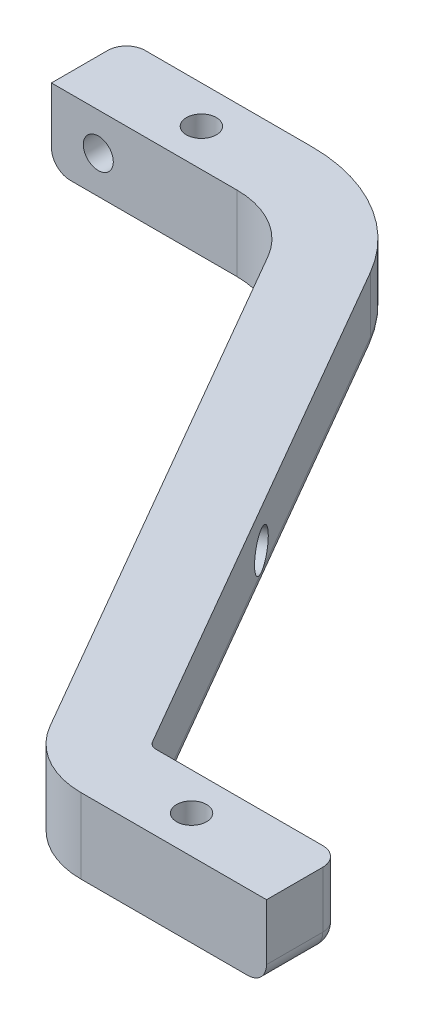
from build123d import *

# Parameters (mm, degrees)
EXTRU_MINCE1_DEPTH      = 8
ESQUISSE2_R             = 1.6
ENL_V_MAT_EXTRU_1_DEPTH = 109.260681026
ESQUISSE3_R             = 2
ENL_V_MAT_EXTRU_2_DEPTH = 5.5
ESQUISSE4_R             = 1.6
ENL_V_MAT_EXTRU_3_DEPTH = 109.260681026
ESQUISSE5_R             = 2
ENL_V_MAT_EXTRU_4_DEPTH = 5.5
ESQUISSE7_R             = 1.6
ENL_V_MAT_EXTRU_5_DEPTH = 102.558480966
ESQUISSE8_R             = 2
ENL_V_MAT_EXTRU_6_DEPTH = 5.5
CONG_1_R                = 2


with BuildPart() as part:
    # Esquisse1 → Extru.-Mince1 (new body)
    with BuildSketch(Plane(origin=(0, 0, 0), x_dir=(1, 0, 0), z_dir=(0, 1, 0))):
        with BuildLine():
            Line((0, 0), (19.803847577, 0))
            ThreePointArc((19.803847577, 0), (24.303847577, -1.205771366), (27.598076211, -4.5))
            Line((27.598076211, -4.5), (59.352341017, -59.5))
            ThreePointArc((59.352341017, -59.5), (62.646569651, -62.794228634), (67.146569651, -64))
            Line((67.146569651, -64), (86.950417228, -64))
            Line((86.950417228, -64), (86.950417228, -56))
            Line((86.950417228, -56), (67.146569651, -56))
            ThreePointArc((67.146569651, -56), (66.646569651, -55.866025404), (66.280544247, -55.5))
            Line((66.280544247, -55.5), (34.526279442, -0.5))
            ThreePointArc((34.526279442, -0.5), (28.303847577, 5.722431864), (19.803847577, 8))
            Line((19.803847577, 8), (0, 8))
            Line((0, 8), (0, 0))
        make_face()
    extrude(amount=EXTRU_MINCE1_DEPTH)

    # Esquisse2 → Enlèv. mat.-Extru.1 (cut, through all)
    with BuildSketch(Plane(origin=(0, 8, 0), x_dir=(1, 0, 0), z_dir=(0, 1, 0))):
        with Locations(Location((74.950417228, -60, 0), (0, 0, 270))):
            Circle(ESQUISSE2_R)
        with Locations(Location((12, 4, 0), (0, 0, 270))):
            Circle(ESQUISSE2_R)
    extrude(amount=-ENL_V_MAT_EXTRU_1_DEPTH, mode=Mode.SUBTRACT)

    # Esquisse3 → Enlèv. mat.-Extru.2 (cut)
    with BuildSketch(Plane.XZ):
        with Locations(Location((74.950417228, 60, 0), (0, 0, 270))):
            Circle(ESQUISSE3_R)
        with Locations(Location((12, -4, 0), (0, 0, 270))):
            Circle(ESQUISSE3_R)
    extrude(amount=-ENL_V_MAT_EXTRU_2_DEPTH, mode=Mode.SUBTRACT)

    # Esquisse4 → Enlèv. mat.-Extru.3 (cut, through all)
    with BuildSketch(Plane(origin=(0, 0, 0), x_dir=(-1, 0, 0), z_dir=(0, 0, -1))):
        with Locations((-5, 4)):
            Circle(ESQUISSE4_R)
    extrude(amount=ENL_V_MAT_EXTRU_3_DEPTH, mode=Mode.SUBTRACT)

    # Esquisse5 → Enlèv. mat.-Extru.4 (cut)
    with BuildSketch(Plane.XY.offset(-8)):
        with Locations((5, 4)):
            Circle(ESQUISSE5_R)
    extrude(amount=ENL_V_MAT_EXTRU_4_DEPTH, mode=Mode.SUBTRACT)

    # Esquisse7 → Enlèv. mat.-Extru.5 (cut, through all)
    with BuildSketch(Plane(origin=(18.75, 0, -10.825317547), x_dir=(0.499999999999998, 0, 0.8660254037844398), z_dir=(-0.8660254037844399, 0, 0.49999999999999806))):
        with Locations((49.450417228, 4)):
            Circle(ESQUISSE7_R)
    extrude(amount=-ENL_V_MAT_EXTRU_5_DEPTH, mode=Mode.SUBTRACT)

    # Esquisse8 → Enlèv. mat.-Extru.6 (cut)
    with BuildSketch(Plane(origin=(25.67820323, 0, -14.825317547), x_dir=(-0.49999999999999806, 0, -0.8660254037844398), z_dir=(0.8660254037844397, 0, -0.499999999999998))):
        with Locations((-49.450417228, 4)):
            Circle(ESQUISSE8_R)
    extrude(amount=-ENL_V_MAT_EXTRU_6_DEPTH, mode=Mode.SUBTRACT)

    # Congé1
    cong_1_edges = [part.edges().sort_by_distance(p)[0] for p in [
        (0, 0, -4),
        (9.901923789, 0, -8),
        (28.303847577, 0, -5.722431864),
        (50.403411844, 0, 28),
        (66.646569651, 0, 55.866025404),
        (77.048493439, 0, 56),
        (86.950417228, 0, 60),
        (0, 4, -8),
        (86.950417228, 4, 56),
    ]]
    fillet(cong_1_edges, radius=CONG_1_R - 0.0001)  # a hair under: the kernel refuses the full size


solid = part.part
